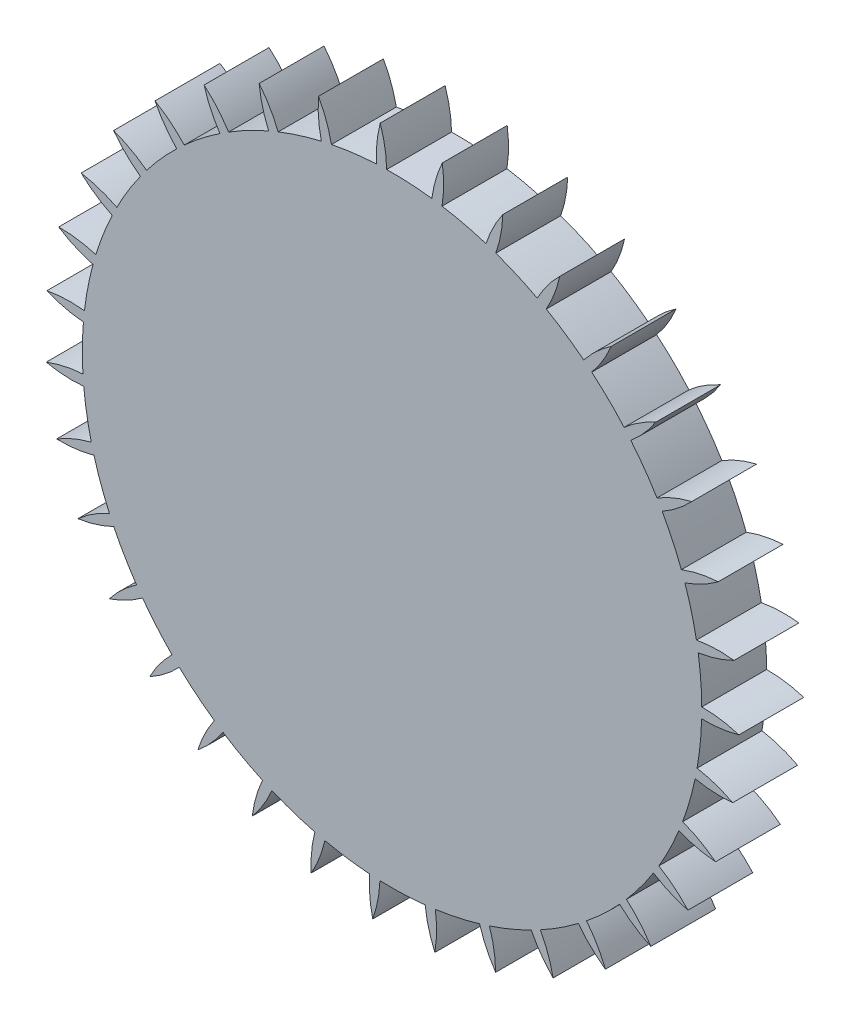
from build123d import *

# Parameters (mm, degrees)
SKETCH1_R           = 27.75
BOSS_EXTRUDE1_DEPTH = 2.5
CUT_EXTRUDE2_START  = -5
CUT_EXTRUDE2_DEPTH  = 45.561660734
CIRPATTERN7_START   = -2.5
CIRPATTERN7_DEPTH   = 5


# Read off the part's stored shape, not the designer's step: CirPattern7
with BuildPart() as part:
    # Sketch1 → Boss-Extrude1 (new, symmetric)
    with BuildSketch(Plane.XY):
        Circle(SKETCH1_R)
    extrude(amount=BOSS_EXTRUDE1_DEPTH, both=True)

    # Sketch2 → Cut-Extrude2 (cut)
    with BuildSketch(Plane.XY.offset(2.5).offset(CUT_EXTRUDE2_START)):
        with BuildLine():
            Line((-89.477738944, 138.434122816), (-6.339011816, 27.016280817))
            ThreePointArc((-6.339011816, 27.016280817), (-5.280523031, 25.210404562), (-4.64520927, 23.215921174))
            ThreePointArc((-4.64520927, 23.215921174), (-2.923319917, 23.494917872), (-1.18556258, 23.646382525))
            ThreePointArc((-1.18556258, 23.646382525), (-1.058374477, 25.735739063), (-0.474695323, 27.745939601))
            Line((-0.474695323, 27.745939601), (52.825792272, 156.14002625))
            Line((52.825792272, 156.14002625), (18.496309012, 432.048381388))
            Line((18.496309012, 432.048381388), (-123.807222203, 414.342477955))
            Line((-123.807222203, 414.342477955), (-89.477738944, 138.434122816))
        make_face()
    extrude(amount=CUT_EXTRUDE2_DEPTH, mode=Mode.SUBTRACT)

    # CirPattern7 outline → CirPattern7 (cut)
    with BuildSketch(Plane.XY.offset(CIRPATTERN7_START)):
        with BuildLine():
            ThreePointArc((3.090231156, 23.479240771), (3.387839331, 24.901248443), (3.899737771, 26.260894145))
            ThreePointArc((3.899737771, 26.260894145), (4.000041355, 24.811544071), (3.877171664, 23.363932423))
            ThreePointArc((3.877171664, 23.363932423), (5.587296935, 23.020110291), (7.267466816, 22.551312602))
            ThreePointArc((7.267466816, 22.551312602), (7.814201579, 23.897328035), (8.560647715, 25.143720674))
            ThreePointArc((8.560647715, 25.143720674), (8.40054793, 23.699752356), (8.021171765, 22.297343653))
            ThreePointArc((8.021171765, 22.297343653), (9.642422807, 21.653692226), (11.211884607, 20.892422392))
            ThreePointArc((11.211884607, 20.892422392), (11.990173454, 22.119183541), (12.947175892, 23.212263034))
            ThreePointArc((12.947175892, 23.212263034), (12.531818479, 21.820086801), (11.9081293, 20.507955613))
            ThreePointArc((11.9081293, 20.507955613), (13.388397772, 19.585162378), (14.796707697, 18.555888238))
            ThreePointArc((14.796707697, 18.555888238), (15.781535783, 19.623965991), (16.918335679, 20.528599863))
            ThreePointArc((16.918335679, 20.528599863), (16.261070565, 19.232961405), (15.413114258, 18.053280708))
            ThreePointArc((15.413114258, 18.053280708), (16.704823111, 16.881004998), (17.906716922, 15.616808269))
            ThreePointArc((17.906716922, 15.616808269), (19.066431063, 16.491873729), (20.346490732, 17.178986303))
            ThreePointArc((20.346490732, 17.178986303), (19.468442959, 16.021528506), (18.423473536, 15.012214208))
            ThreePointArc((18.423473536, 15.012214208), (19.485106186, 13.628133929), (20.441954027, 12.169646935))
            ThreePointArc((20.441954027, 12.169646935), (21.739280055, 12.823574777), (23.121457326, 13.271081689))
            ThreePointArc((23.121457326, 13.271081689), (22.050848071, 12.289006199), (20.842451711, 11.482498492))
            ThreePointArc((20.842451711, 11.482498492), (21.63988641, 9.931099123), (22.320934405, 8.325198837))
            ThreePointArc((22.320934405, 8.325198837), (23.714175195, 8.736971281), (25.154045753, 8.930489292))
            ThreePointArc((25.154045753, 8.930489292), (23.92528528, 8.155360823), (22.592300834, 7.577581529))
            ThreePointArc((22.592300834, 7.577581529), (23.099907376, 5.908726323), (23.48326608, 4.207027699))
            ThreePointArc((23.48326608, 4.207027699), (24.927641727, 4.363410042), (26.378926948, 4.296719323))
            ThreePointArc((26.378926948, 4.296719323), (25.031508628, 3.753451142), (23.616779314, 3.422970562))
            ThreePointArc((23.616779314, 3.422970562), (23.818242806, 1.690297897), (23.891590756, -0.052505069))
            ThreePointArc((23.891590756, -0.052505069), (25.340677838, -0.156539085), (26.756732221, -0.481295039))
            ThreePointArc((26.756732221, -0.481295039), (25.333963188, -0.775241846), (23.88295957, -0.847801793))
            ThreePointArc((23.88295957, -0.847801793), (23.771804811, -2.588602391), (23.532784543, -4.316494579))
            ThreePointArc((23.532784543, -4.316494579), (24.940008208, -4.677601215), (26.2753186, -5.249984481))
            ThreePointArc((26.2753186, -5.249984481), (24.822927822, -5.285162221), (23.38228635, -5.0974694))
            ThreePointArc((23.38228635, -5.0974694), (22.962085944, -6.790447167), (22.418379767, -8.4478927))
            ThreePointArc((22.418379767, -8.4478927), (23.738510689, -9.054465692), (24.950159115, -9.856079401))
            ThreePointArc((24.950159115, -9.856079401), (23.514827626, -9.631357433), (22.130851702, -9.189444445))
            ThreePointArc((22.130851702, -9.189444445), (21.415111237, -10.780185683), (20.584194314, -12.313912898))
            ThreePointArc((20.584194314, -12.313912898), (21.774802399, -13.14645649), (22.823845482, -14.151536117))
            ThreePointArc((22.823845482, -14.151536117), (21.451706017, -13.67413719), (20.168877767, -12.992207482))
            ThreePointArc((20.168877767, -12.992207482), (19.180601729, -14.429584459), (18.089180414, -15.790298101))
            ThreePointArc((18.089180414, -15.790298101), (19.111998539, -16.822053658), (19.964719171, -17.998295117))
            ThreePointArc((19.964719171, -17.998295117), (18.699873422, -17.283563225), (17.559424, -16.38353458))
            ThreePointArc((17.559424, -16.38353458), (16.330376395, -17.621348817), (15.013529867, -18.76531443))
            ThreePointArc((15.013529867, -18.76531443), (15.835683816, -19.963120479), (16.464674853, -21.272718402))
            ThreePointArc((16.464674853, -21.272718402), (15.347776003, -20.343625616), (14.386360394, -19.254425694))
            ThreePointArc((14.386360394, -19.254425694), (12.956043823, -20.252892823), (11.456096612, -21.143342411))
            ThreePointArc((11.456096612, -21.143342411), (12.05116168, -22.46870048), (12.436206834, -23.869563312))
            ThreePointArc((12.436206834, -23.869563312), (11.503152931, -22.755971439), (10.751671822, -21.512608022))
            ThreePointArc((10.751671822, -21.512608022), (9.166057836, -22.239636488), (7.531219481, -22.847950269))
            ThreePointArc((7.531219481, -22.847950269), (7.880069787, -24.258262259), (8.00879339, -25.705365116))
            ThreePointArc((8.00879339, -25.705365116), (7.289573554, -24.443065915), (6.772180166, -23.085501726))
            ThreePointArc((6.772180166, -23.085501726), (5.082231704, -23.517724236), (3.365047255, -23.824350504))
            ThreePointArc((3.365047255, -23.824350504), (3.456470463, -25.274287827), (3.324735232, -26.721119633))
            ThreePointArc((3.324735232, -26.721119633), (2.84246578, -25.350684439), (2.575789563, -23.922552708))
            ThreePointArc((2.575789563, -23.922552708), (0.835822959, -24.046077275), (-0.908515864, -24.041160809))
            ThreePointArc((-0.908515864, -24.041160809), (-1.077458171, -25.484121288), (-1.465418157, -26.884179678))
            ThreePointArc((-1.465418157, -26.884179678), (-1.695236688, -25.449655405), (-1.702624541, -23.996857461))
            ThreePointArc((-1.702624541, -23.996857461), (-3.436685329, -23.807713904), (-5.152114041, -23.491412724))
            ThreePointArc((-5.152114041, -23.491412724), (-5.575991918, -24.88101842), (-6.207707306, -26.189304365))
            ThreePointArc((-6.207707306, -26.189304365), (-6.177688358, -24.736797805), (-5.925550396, -23.30602777))
            ThreePointArc((-5.925550396, -23.30602777), (-7.597971228, -22.810295317), (-9.229354538, -22.192775603))
            ThreePointArc((-9.229354538, -22.192775603), (-9.894544201, -23.484363447), (-10.749711139, -24.658827561))
            ThreePointArc((-10.749711139, -24.658827561), (-10.460819547, -23.235023468), (-9.957259691, -21.872267467))
            ThreePointArc((-9.957259691, -21.872267467), (-11.514287585, -21.085879369), (-13.009191491, -20.186988713))
            ThreePointArc((-13.009191491, -20.186988713), (-13.894313197, -21.339046008), (-14.945445916, -22.341940047))
            ThreePointArc((-14.945445916, -22.341940047), (-14.406966893, -20.992600658), (-13.668169972, -19.741658791))
            ThreePointArc((-13.668169972, -19.741658791), (-15.059760769, -18.689890207), (-16.370137831, -17.538519694))
            ThreePointArc((-16.370137831, -17.538519694), (-17.44674304, -18.514018371), (-18.660057269, -19.313108496))
            ThreePointArc((-18.660057269, -19.313108496), (-17.889297974, -18.081602688), (-16.939009528, -16.982681256))
            ThreePointArc((-16.939009528, -16.982681256), (-18.120436356, -15.699336894), (-19.204169976, -14.33249252))
            ThreePointArc((-19.204169976, -14.33249252), (-20.437655711, -15.100079248), (-21.774154532, -15.669682045))
            ThreePointArc((-21.774154532, -15.669682045), (-20.795887804, -14.595591428), (-19.664650885, -13.68401067))
            ThreePointArc((-19.664650885, -13.68401067), (-20.597941714, -12.210338274), (-21.420199801, -10.671951541))
            ThreePointArc((-21.420199801, -10.671951541), (-22.770920816, -11.206955453), (-24.187648058, -11.528763419))
            ThreePointArc((-24.187648058, -11.528763419), (-23.033316193, -10.64661015), (-21.757489688, -9.95166902))
            ThreePointArc((-21.757489688, -9.95166902), (-22.412647782, -8.335033634), (-22.947002286, -6.674549558))
            ThreePointArc((-22.947002286, -6.674549558), (-24.371545295, -6.959775187), (-25.822966179, -7.023445149))
            ThreePointArc((-25.822966179, -7.023445149), (-24.529670354, -6.361582359), (-23.150260375, -5.905616839))
            ThreePointArc((-23.150260375, -5.905616839), (-23.506228415, -4.197978453), (-23.735504741, -2.468766359))
            ThreePointArc((-23.735504741, -2.468766359), (-25.188083761, -2.495046318), (-26.627548424, -2.298531872))
            ThreePointArc((-26.627548424, -2.298531872), (-25.23685623, -1.878232376), (-23.79819815, -1.675897571))
            ThreePointArc((-23.79819815, -1.675897571), (-23.843535029, 0.067858911), (-23.760364049, 1.810220724))
            ThreePointArc((-23.760364049, 1.810220724), (-25.194291994, 2.043731094), (-26.575534859, 2.494113813))
            ThreePointArc((-26.575534859, 2.494113813), (-25.132144288, 2.659341243), (-23.68047776, 2.601542124))
            ThreePointArc((-23.68047776, 2.601542124), (-23.413726315, 4.325370935), (-23.020781211, 6.024881525))
            ThreePointArc((-23.020781211, 6.024881525), (-24.389970458, 6.510677009), (-25.668597242, 7.200452329))
            ThreePointArc((-25.668597242, 7.200452329), (-24.218900054, 7.105297148), (-22.800882836, 6.789221817))
            ThreePointArc((-22.800882836, 6.789221817), (-22.230616676, 8.43771768), (-21.540527028, 10.039753379))
            ThreePointArc((-21.540527028, 10.039753379), (-22.800970707, 10.762220109), (-23.935885294, 11.669218084))
            ThreePointArc((-23.935885294, 11.669218084), (-22.52647595, 11.316738658), (-21.187684281, 10.752546037))
            ThreePointArc((-21.187684281, 10.752546037), (-20.332232231, 12.272724938), (-19.367178088, 13.725794999))
            ThreePointArc((-19.367178088, 13.725794999), (-20.478364503, 14.661712301), (-21.433089803, 15.75678127))
            ThreePointArc((-21.433089803, 15.75678127), (-20.109267878, 15.158306577), (-18.892731625, 14.36413028))
            ThreePointArc((-18.892731625, 14.36413028), (-17.779588617, 15.70713242), (-16.570587613, 16.964533976))
            ThreePointArc((-16.570587613, 16.964533976), (-17.496802318, 18.083820698), (-18.240652676, 19.331764243))
            ThreePointArc((-18.240652676, 19.331764243), (-17.044966897, 18.506529753), (-15.989786535, 17.50789526))
            ThreePointArc((-15.989786535, 17.50789526), (-14.654729902, 18.630555443), (-13.240640324, 19.651874574))
            ThreePointArc((-13.240640324, 19.651874574), (-13.952114016, 20.918555919), (-14.461181467, 22.279264108))
            ThreePointArc((-14.461181467, 22.279264108), (-13.432062159, 21.253793536), (-12.572152054, 20.082797781))
            ThreePointArc((-12.572152054, 20.082797781), (-11.058091614, 20.949032787), (-9.484363464, 21.701443455))
            ThreePointArc((-9.484363464, 21.701443455), (-9.958228794, 23.074807243), (-10.216151493, 24.504545795))
            ThreePointArc((-10.216151493, 24.504545795), (-9.386675397, 23.311798609), (-8.749673767, 22.00607836))
            ThreePointArc((-8.749673767, 22.00607836), (-7.105272668, 22.588046681), (-5.422486865, 23.047365789))
            ThreePointArc((-5.422486865, 23.047365789), (-5.643513409, 24.483270978), (-5.642001509, 25.936086919))
            ThreePointArc((-5.642001509, 25.936086919), (-5.972131243, 26.488040866), (-6.339011816, 27.016280817))
            ThreePointArc((-6.339011816, 27.016280817), (3.426332111, -27.537660545), (-0.474695323, 27.745939601))
            ThreePointArc((-0.474695323, 27.745939601), (-0.700942634, 27.143900603), (-0.885748459, 26.527876571))
            ThreePointArc((-0.885748459, 26.527876571), (-0.528265346, 25.119728046), (-0.39067943, 23.673440882))
            ThreePointArc((-0.39067943, 23.673440882), (1.353355237, 23.640498771), (3.090231156, 23.479240771))
        make_face()
    extrude(amount=CIRPATTERN7_DEPTH, mode=Mode.SUBTRACT)


solid = part.part
